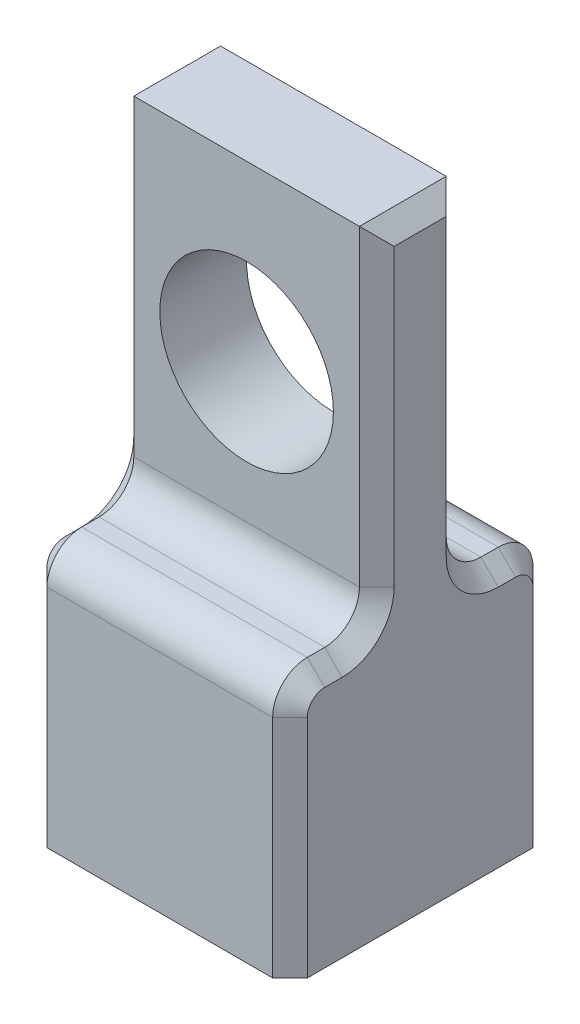
from build123d import *

# Parameters (mm, degrees)
SKETCH1_W           = 15
SKETCH1_H           = 15
BOSS_EXTRUDE1_DEPTH = 35
SKETCH2_R           = 5
CUT_EXTRUDE1_DEPTH  = 25
SKETCH3_W           = 15
SKETCH3_H           = 5
CUT_EXTRUDE2_DEPTH  = 20
FILLET4_R           = 2
CHAMFER1_SIZE       = 1
SKETCH4_R           = 1.5
CUT_EXTRUDE3_DEPTH  = 10


with BuildPart() as part:
    # Sketch1 → Boss-Extrude1 (new body)
    with BuildSketch(Plane(origin=(0, 0, 0), x_dir=(1, 0, 0), z_dir=(0, 1, 0))):
        Rectangle(SKETCH1_W, SKETCH1_H)
    extrude(amount=BOSS_EXTRUDE1_DEPTH)

    # Sketch2 → Cut-Extrude1 (cut)
    with BuildSketch(Plane.XY.offset(7.5)):
        with Locations((0, 25)):
            Circle(SKETCH2_R)
    extrude(amount=-CUT_EXTRUDE1_DEPTH, mode=Mode.SUBTRACT)

    # Sketch3 → Cut-Extrude2 (cut)
    with BuildSketch(Plane(origin=(0, 35, 0), x_dir=(1, 0, 0), z_dir=(0, 1, 0))):
        with Locations((0, 5)):
            Rectangle(SKETCH3_W, SKETCH3_H)
        with Locations((0, -5)):
            Rectangle(SKETCH3_W, SKETCH3_H)
    extrude(amount=-CUT_EXTRUDE2_DEPTH, mode=Mode.SUBTRACT)

    # Fillet4
    fillet4_edges = [part.edges().sort_by_distance(p)[0] for p in [
        (0, 15, 7.5),
        (0, 15, -7.5),
        (0, 15, -2.5),
        (0, 15, 2.5),
    ]]
    fillet(fillet4_edges, radius=FILLET4_R)

    # Chamfer1
    chamfer1_edges = [part.edges().sort_by_distance(p)[0] for p in [
        (7.5, 35, 0),
        (-7.5, 35, 0),
        (-7.5, 6.5, 7.5),
        (-7.5, 14.414213562, 6.914213562),
        (-7.5, 15, 5),
        (-7.5, 26, 2.5),
        (-7.5, 15.585786438, 3.085786438),
        (-7.5, 26, -2.5),
        (-7.5, 15.585786438, -3.085786438),
        (-7.5, 15, -5),
        (-7.5, 6.5, -7.5),
        (-7.5, 14.414213562, -6.914213562),
        (7.5, 6.5, -7.5),
        (7.5, 14.414213562, -6.914213562),
        (7.5, 15, -5),
        (7.5, 26, -2.5),
        (7.5, 15.585786438, -3.085786438),
        (7.5, 26, 2.5),
        (7.5, 15.585786438, 3.085786438),
        (7.5, 15, 5),
        (7.5, 6.5, 7.5),
        (7.5, 14.414213562, 6.914213562),
    ]]
    chamfer(chamfer1_edges, length=CHAMFER1_SIZE)

    # Sketch4 → Cut-Extrude3 (cut)
    with BuildSketch(Plane.XZ):
        with Locations((0, 4)):
            Circle(SKETCH4_R)
        with Locations((0, -4)):
            Circle(SKETCH4_R)
    extrude(amount=-CUT_EXTRUDE3_DEPTH, mode=Mode.SUBTRACT)


solid = part.part
